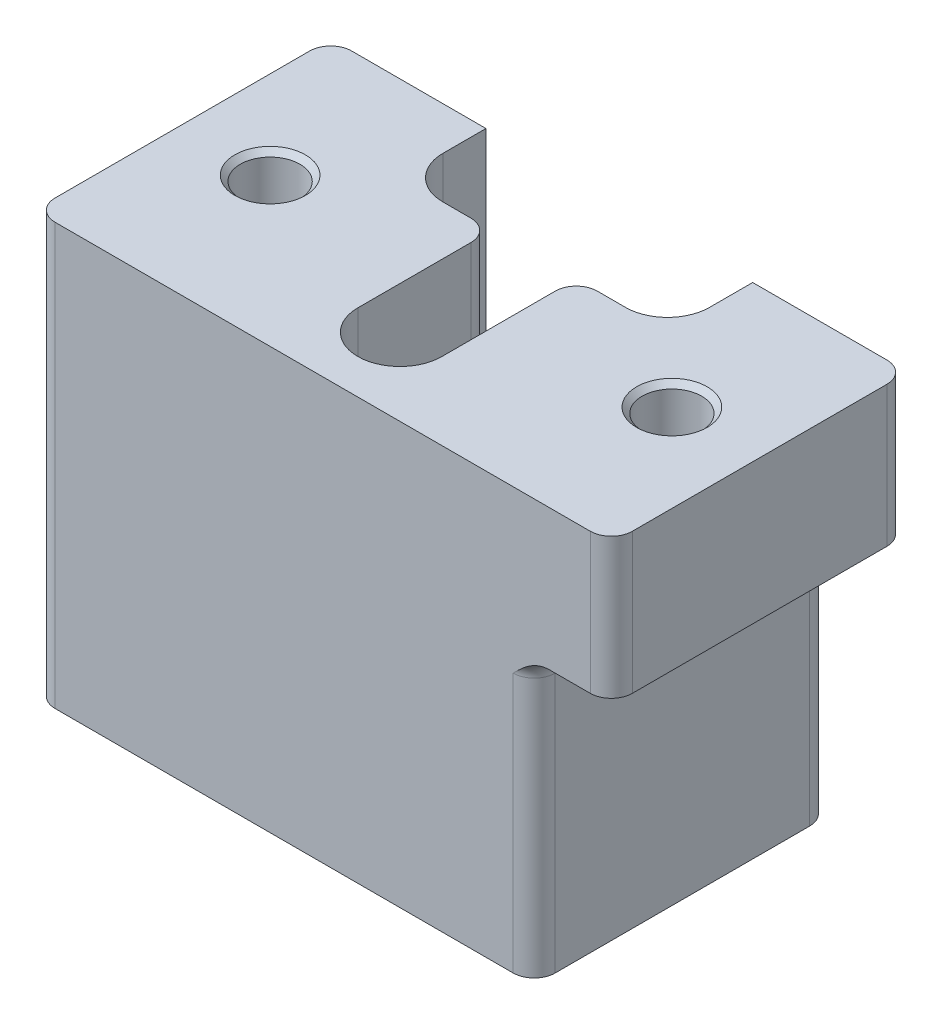
from build123d import *

# Parameters (mm, degrees)
SKETCH2_W                    = 82.24
SKETCH2_H                    = 42.26
BOSS_EXTRUDE1_DEPTH          = 60
FILLET1_R                    = 3
SKETCH5_OUTSIDE_W            = 106.284
SKETCH5_OUTSIDE_H            = 66.304
CUT_EXTRUDE2_DEPTH           = 40
CUT_EXTRUDE3_DEPTH           = 76.745173444
FILLET2_R                    = 3
FILLET3_R                    = 3
M10_TAPPED_HOLE1_D           = 8.5
M10_TAPPED_HOLE1_DEPTH       = 16.946342369
M10_TAPPED_HOLE1_CSINK_D     = 10.05
M10_TAPPED_HOLE1_CSINK_ANGLE = 90
M10_TAPPED_HOLE1_TIP         = 2.553657631


with BuildPart() as part:
    # Sketch2 → Boss-Extrude1 (new body)
    with BuildSketch(Plane(origin=(0, 0, 0), x_dir=(1, 0, 0), z_dir=(0, 1, 0))):
        Rectangle(SKETCH2_W, SKETCH2_H)
    extrude(amount=-BOSS_EXTRUDE1_DEPTH)

    # Fillet1
    fillet1_edges = [part.edges().sort_by_distance(p)[0] for p in [
        (41.12, -30, 21.13),
        (-41.12, -30, 21.13),
        (-41.12, -30, -21.13),
        (41.12, -30, -21.13),
    ]]
    fillet(fillet1_edges, radius=FILLET1_R)

    # Sketch5 outside → Cut-Extrude2 (cut)
    with BuildSketch(Plane.XZ.offset(60)):
        Rectangle(SKETCH5_OUTSIDE_W, SKETCH5_OUTSIDE_H)
        with BuildLine():
            Line((19, -21.13), (30.13, -21.13))
            Line((30.13, -21.13), (30.13, 21.13))
            Line((30.13, 21.13), (-41.12, 21.13))
            Line((-41.12, 21.13), (-41.12, -21.13))
            Line((-41.12, -21.13), (-19, -21.13))
            Line((-19, -21.13), (-19, -15))
            ThreePointArc((-19, -15), (-17.242640687, -10.757359313), (-13, -9))
            Line((-13, -9), (-9, -9))
            ThreePointArc((-9, -9), (-6.878679656, -8.121320344), (-6, -6))
            Line((-6, -6), (-6, 10.13))
            ThreePointArc((-6, 10.13), (0, 16.13), (6, 10.13))
            Line((6, 10.13), (6, -6))
            ThreePointArc((6, -6), (6.878679656, -8.121320344), (9, -9))
            Line((9, -9), (13, -9))
            ThreePointArc((13, -9), (17.242640687, -10.757359313), (19, -15))
            Line((19, -15), (19, -21.13))
        make_face(mode=Mode.SUBTRACT)
    extrude(amount=-CUT_EXTRUDE2_DEPTH, mode=Mode.SUBTRACT)

    # Sketch6 → Cut-Extrude3 (cut, through all)
    with BuildSketch(Plane.XZ.offset(60)):
        with BuildLine():
            Line((-13, -9), (-9, -9))
            ThreePointArc((-9, -9), (-6.878679656, -8.121320344), (-6, -6))
            Line((-6, -6), (-6, 10.13))
            ThreePointArc((-6, 10.13), (0, 16.13), (6, 10.13))
            Line((6, 10.13), (6, -6))
            ThreePointArc((6, -6), (6.878679656, -8.121320344), (9, -9))
            Line((9, -9), (13, -9))
            ThreePointArc((13, -9), (17.242640687, -10.757359313), (19, -15))
            Line((19, -15), (19, -21.13))
            Line((19, -21.13), (-19, -21.13))
            Line((-19, -21.13), (-19, -15))
            ThreePointArc((-19, -15), (-17.242640687, -10.757359313), (-13, -9))
        make_face()
    extrude(amount=-CUT_EXTRUDE3_DEPTH, mode=Mode.SUBTRACT)

    # Fillet2
    fillet2_edges = [part.edges().sort_by_distance(p)[0] for p in [
        (30.13, -40, 21.13),
        (30.13, -40, -21.13),
    ]]
    fillet(fillet2_edges, radius=FILLET2_R)

    # Fillet3
    # the kernel refuses this fillet: 3 mm, written as the material it adds along each edge
    with BuildSketch(Plane(origin=(30.13, -20, -18.13), x_dir=(0, -1, 0), z_dir=(0, 0, 1))) as fillet3_piece_1:
        with BuildLine():
            CenterArc((FILLET3_R, FILLET3_R), FILLET3_R, 180, 90)
            Line((0, FILLET3_R), (0, 0))
            Line((0, 0), (FILLET3_R, 0))
        make_face()
    extrude(amount=36.26)
    with BuildSketch(Plane(origin=(27.13, -20, 18.13), x_dir=(-0.5976672776328266, 0, -0.801744239297649), z_dir=(0.801744239297649, 0, -0.5976672776328266))) as fillet3_piece_2_section:
        with BuildLine():
            CenterArc((3 + FILLET3_R, -FILLET3_R), FILLET3_R, 90, 90)
            Line((3, -FILLET3_R), (3, 0))
            Line((3, 0), (3 + FILLET3_R, 0))
        make_face()
    fillet3_piece_2 = revolve(axis=Axis((27.13, -20, 18.13), (0, 1, 0)), revolution_arc=233.296989237, mode=Mode.PRIVATE)
    fillet3_piece_2 = split(fillet3_piece_2, bisect_by=Plane(origin=(29.379816868, -20.934884818, 21.13), z_dir=(0, 0, -1)), keep=Keep.TOP, mode=Mode.PRIVATE)
    add(fillet3_piece_2)
    with BuildSketch(Plane(origin=(27.13, -20, -18.13), x_dir=(-0.5976672776328287, 0, 0.8017442392976475), z_dir=(0.8017442392976475, 0, 0.5976672776328287))) as fillet3_piece_3_section:
        with BuildLine():
            CenterArc((3 + FILLET3_R, FILLET3_R), FILLET3_R, 180, 90)
            Line((3 + FILLET3_R, 0), (3, 0))
            Line((3, 0), (3, FILLET3_R))
        make_face()
    fillet3_piece_3 = revolve(axis=Axis((27.13, -20, -18.13), (0, -1, 0)), revolution_arc=233.296989237, mode=Mode.PRIVATE)
    fillet3_piece_3 = split(fillet3_piece_3, bisect_by=Plane(origin=(29.379816762, -20.934885263, -21.13), z_dir=(0, 0, 1)), keep=Keep.TOP, mode=Mode.PRIVATE)
    add(fillet3_piece_3)

    # M10 Tapped Hole1
    with Locations(Plane(origin=(0, 0, 0), x_dir=(1, 0, 0), z_dir=(0, 1, 0))):
        with Locations((28.62, 0), (-28.62, 0)):
            CounterSinkHole(M10_TAPPED_HOLE1_D / 2, M10_TAPPED_HOLE1_CSINK_D / 2, depth=M10_TAPPED_HOLE1_DEPTH, counter_sink_angle=M10_TAPPED_HOLE1_CSINK_ANGLE)
            with Locations((0, 0, -(M10_TAPPED_HOLE1_DEPTH + M10_TAPPED_HOLE1_TIP / 2))):  # 118° drill point
                Cone(0, M10_TAPPED_HOLE1_D / 2, M10_TAPPED_HOLE1_TIP, mode=Mode.SUBTRACT)


solid = part.part
